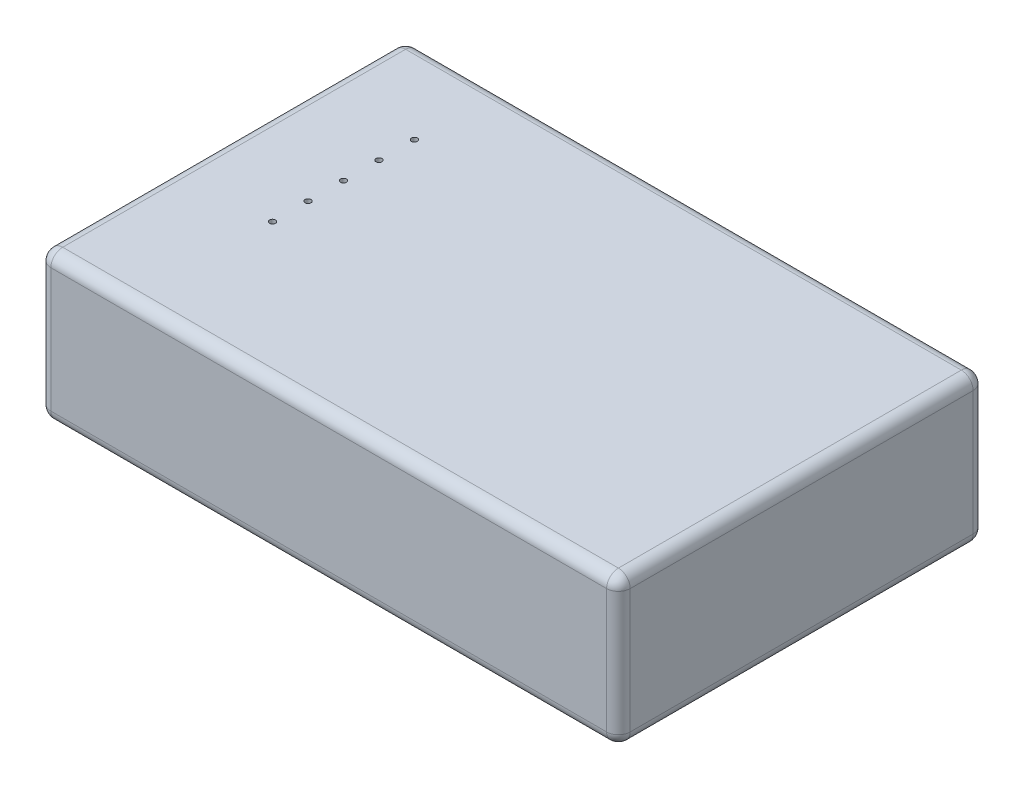
from build123d import *

# Parameters (mm, degrees)
SKETCH2_W           = 98
SKETCH2_H           = 62
BOSS_EXTRUDE1_DEPTH = 25
SKETCH3_W           = 9.5
SKETCH3_H           = 12
BOSS_EXTRUDE4_DEPTH = 1
SKETCH3_5_W         = 9.5
SKETCH3_5_H         = 12
CUT_EXTRUDE1_DEPTH  = 1
SKETCH4_R           = 3.25
CUT_EXTRUDE2_DEPTH  = 10
SKETCH5_R           = 0.5
BOSS_EXTRUDE5_DEPTH = 8
SKETCH6_W           = 7
SKETCH6_H           = 14
CUT_EXTRUDE9_DEPTH  = 10
SKETCH7_W           = 1.559437484
SKETCH7_H           = 10
BOSS_EXTRUDE6_DEPTH = 9
SKETCH8_W           = 15
SKETCH8_H           = 10
BOSS_EXTRUDE7_DEPTH = 2
BOSS_EXTRUDE7_TAPER = 30
BOSS_EXTRUDE8_DEPTH = 6
FILLET5_R           = 2
SKETCH10_R          = 2.5
CUT_EXTRUDE10_DEPTH = 6
SKETCH11_R          = 0.5
CUT_EXTRUDE11_DEPTH = 3


with BuildPart() as part:
    # Sketch2 → Boss-Extrude1 (new body)
    with BuildSketch(Plane(origin=(0, 0, 0), x_dir=(1, 0, 0), z_dir=(0, 1, 0))):
        Rectangle(SKETCH2_W, SKETCH2_H)
    extrude(amount=BOSS_EXTRUDE1_DEPTH)

    # Sketch3 → Boss-Extrude4 (add)
    with BuildSketch(Plane.ZY.offset(49)):
        with Locations((-18.656971736, 15)):
            Rectangle(SKETCH3_W, SKETCH3_H)
    extrude(amount=-BOSS_EXTRUDE4_DEPTH)

    # Sketch3<5> → Cut-Extrude1 (cut)
    with BuildSketch(Plane.ZY.offset(49)):
        with Locations((-18.656971736, 15)):
            Rectangle(SKETCH3_5_W, SKETCH3_5_H)
    extrude(amount=-CUT_EXTRUDE1_DEPTH, mode=Mode.SUBTRACT)

    # Sketch4 → Cut-Extrude2 (cut)
    with BuildSketch(Plane.ZY.offset(48)):
        with Locations((-18.406971736, 16)):
            Circle(SKETCH4_R)
    extrude(amount=-CUT_EXTRUDE2_DEPTH, mode=Mode.SUBTRACT)

    # Sketch5 → Boss-Extrude5 (add)
    with BuildSketch(Plane.ZY.offset(38)):
        with Locations((-18.406971736, 16)):
            Circle(SKETCH5_R)
    extrude(amount=BOSS_EXTRUDE5_DEPTH)

    # Sketch6 → Cut-Extrude9 (cut)
    with BuildSketch(Plane.ZY.offset(49)):
        with Locations((-6.406971736, 14)):
            Rectangle(SKETCH6_W, SKETCH6_H)
    extrude(amount=-CUT_EXTRUDE9_DEPTH, mode=Mode.SUBTRACT)

    # Sketch7 → Boss-Extrude6 (add)
    with BuildSketch(Plane.ZY.offset(39)):
        with Locations((-4.686690478, 14)):
            Rectangle(SKETCH7_W, SKETCH7_H)
    extrude(amount=BOSS_EXTRUDE6_DEPTH)

    # Sketch8 → Boss-Extrude7 (add)
    with BuildSketch(Plane.ZY.offset(49)):
        with Locations((12.093028264, 15)):
            Rectangle(SKETCH8_W, SKETCH8_H)
    extrude(amount=BOSS_EXTRUDE7_DEPTH, taper=BOSS_EXTRUDE7_TAPER)

    # Sketch9 → Boss-Extrude8 (add)
    with BuildSketch(Plane(origin=(0, 12, 0), x_dir=(-1, 0, 0), z_dir=(0, -1, 0))):
        with BuildLine():
            Line((51, -7.644654734), (51, -16.805465041))
            add(Edge.make_bspline(
                [(53.813384295, -15.000246539), (53.104445278, -16.821688465), (51, -16.805465041)],
                knots=[0, 0, 0, 1, 1, 1], degree=2))
            add(Edge.make_bspline(
                [(51, -7.644654734), (51.419023322, -11.667929153), (53.813384295, -15.000246539)],
                knots=[0, 0, 0, 1, 1, 1], degree=2))
        make_face()
    extrude(amount=-BOSS_EXTRUDE8_DEPTH)

    # Fillet5
    fillet5_edges = [part.edges().sort_by_distance(p)[0] for p in [
        (49, 12.5, -31),
        (0, 25, -31),
        (-49, 12.5, -31),
        (0, 0, -31),
        (-49, 0, 0),
        (-49, 12.5, 31),
        (0, 0, 31),
        (49, 0, 0),
        (49, 25, 0),
        (49, 12.5, 31),
        (-49, 25, 0),
        (0, 25, 31),
    ]]
    fillet(fillet5_edges, radius=FILLET5_R)

    # Sketch10 → Cut-Extrude10 (cut)
    with BuildSketch(Plane.XZ):
        with Locations((-43, -25.5)):
            Circle(SKETCH10_R)
        with Locations((-43, 25.5)):
            Circle(SKETCH10_R)
        with Locations((43, 25.5)):
            Circle(SKETCH10_R)
        with Locations((43, -25.5)):
            Circle(SKETCH10_R)
    extrude(amount=-CUT_EXTRUDE10_DEPTH, mode=Mode.SUBTRACT)

    # Sketch11 → Cut-Extrude11 (cut)
    with BuildSketch(Plane(origin=(0, 25, 0), x_dir=(1, 0, 0), z_dir=(0, 1, 0))):
        with Locations((-33, 16.5)):
            Circle(SKETCH11_R)
        with Locations((-33, 10.5)):
            Circle(SKETCH11_R)
        with Locations((-33, 4.5)):
            Circle(SKETCH11_R)
        with Locations((-33, -1.5)):
            Circle(SKETCH11_R)
        with Locations((-33, -7.5)):
            Circle(SKETCH11_R)
    extrude(amount=-CUT_EXTRUDE11_DEPTH, mode=Mode.SUBTRACT)


solid = part.part
